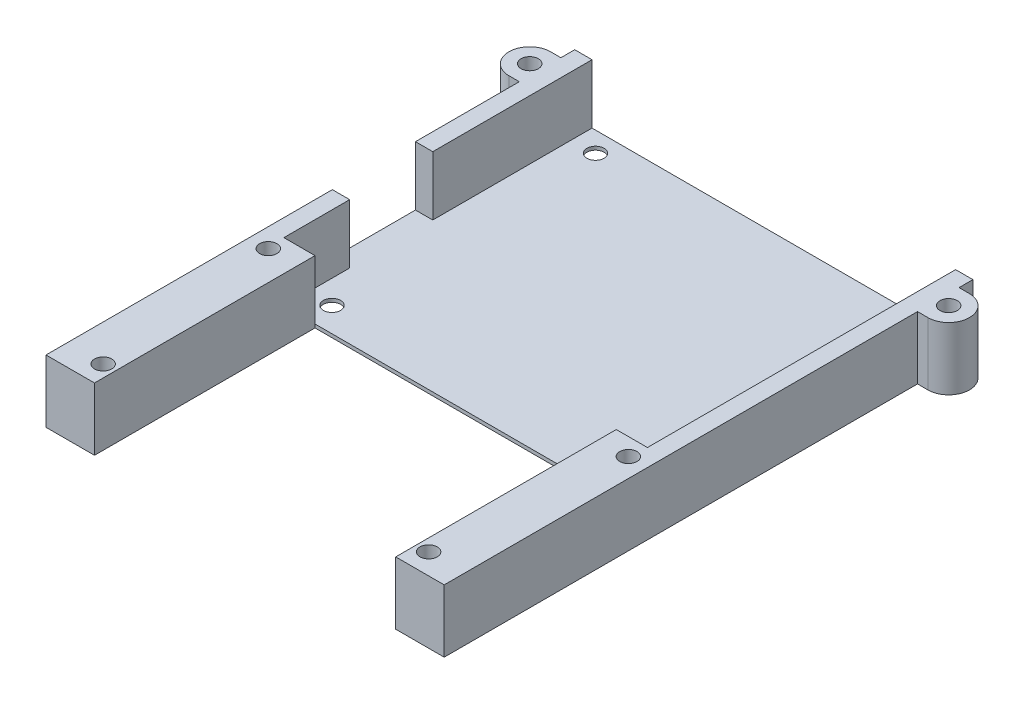
from build123d import *

# Parameters (mm, degrees)
BOSS_EXTRUDE1_DEPTH            = 0.5
BOSS_EXTRUDE2_DEPTH            = 9.05
F_2_5_2_5_DIAMETER_HOLE1_D     = 2.5
F_2_5_2_5_DIAMETER_HOLE1_DEPTH = 12
F_2_5_2_5_DIAMETER_HOLE1_TIP   = 0.751075774


with BuildPart() as part:
    # Sketch1 → Boss-Extrude1 (new body)
    with BuildSketch(Plane(origin=(0, 0, 0), x_dir=(1, 0, 0), z_dir=(0, 1, 0))):
        Polygon((26.25, 31.85), (26.25, 76.35), (-26.25, 76.35), (-26.25, 53.35), (-28.75, 53.35), (-28.75, 41.35), (-26.25, 41.35), (-26.25, 31.85), align=None)
    extrude(amount=BOSS_EXTRUDE1_DEPTH)

    # Sketch1<3> → Boss-Extrude2 (add)
    with BuildSketch(Plane(origin=(0, 0, 0), x_dir=(1, 0, 0), z_dir=(0, 1, 0))):
        with BuildLine():
            Line((-26.25, 76.35), (-28.75, 76.35))
            Line((-28.75, 76.35), (-28.75, 74.35))
            Line((-28.75, 74.35), (-30.25, 74.35))
            ThreePointArc((-30.25, 74.35), (-33.25, 71.35), (-30.25, 68.35))
            Line((-30.25, 68.35), (-28.75, 68.35))
            Line((-28.75, 68.35), (-28.75, 53.35))
            Line((-28.75, 53.35), (-26.25, 53.35))
            Line((-26.25, 53.35), (-26.25, 76.35))
        make_face()
        with BuildLine():
            Line((28.75, 76.35), (26.25, 76.35))
            Line((26.25, 76.35), (26.25, 31.85))
            Line((26.25, 31.85), (21.75, 31.85))
            Line((21.75, 31.85), (21.75, 0))
            Line((21.75, 0), (28.75, 0))
            Line((28.75, 0), (28.75, 68.35))
            Line((28.75, 68.35), (30.25, 68.35))
            ThreePointArc((30.25, 68.35), (33.25, 71.35), (30.25, 74.35))
            Line((30.25, 74.35), (28.75, 74.35))
            Line((28.75, 74.35), (28.75, 76.35))
        make_face()
        Polygon((-26.25, 31.85), (-26.25, 41.35), (-28.75, 41.35), (-28.75, 0), (-21.75, 0), (-21.75, 31.85), align=None)
    extrude(amount=BOSS_EXTRUDE2_DEPTH)

    # Ø2.5 (2.5) Diameter Hole1
    with Locations(Plane(origin=(0, 0, 0), x_dir=(-1, 0, 0), z_dir=(0, -1, 0))):
        with Locations((-22.85, 73.45), (22.85, 73.45), (26, 29.35), (22.85, 35.4), (-22.85, 35.4), (-26, 29.35), (-23.5, 3), (23.5, 3), (-30.25, 71.35), (30.25, 71.35)):
            Hole(F_2_5_2_5_DIAMETER_HOLE1_D / 2, depth=F_2_5_2_5_DIAMETER_HOLE1_DEPTH)
            with Locations((0, 0, -(F_2_5_2_5_DIAMETER_HOLE1_DEPTH + F_2_5_2_5_DIAMETER_HOLE1_TIP / 2))):  # 118° drill point
                Cone(0, F_2_5_2_5_DIAMETER_HOLE1_D / 2, F_2_5_2_5_DIAMETER_HOLE1_TIP, mode=Mode.SUBTRACT)


solid = part.part
